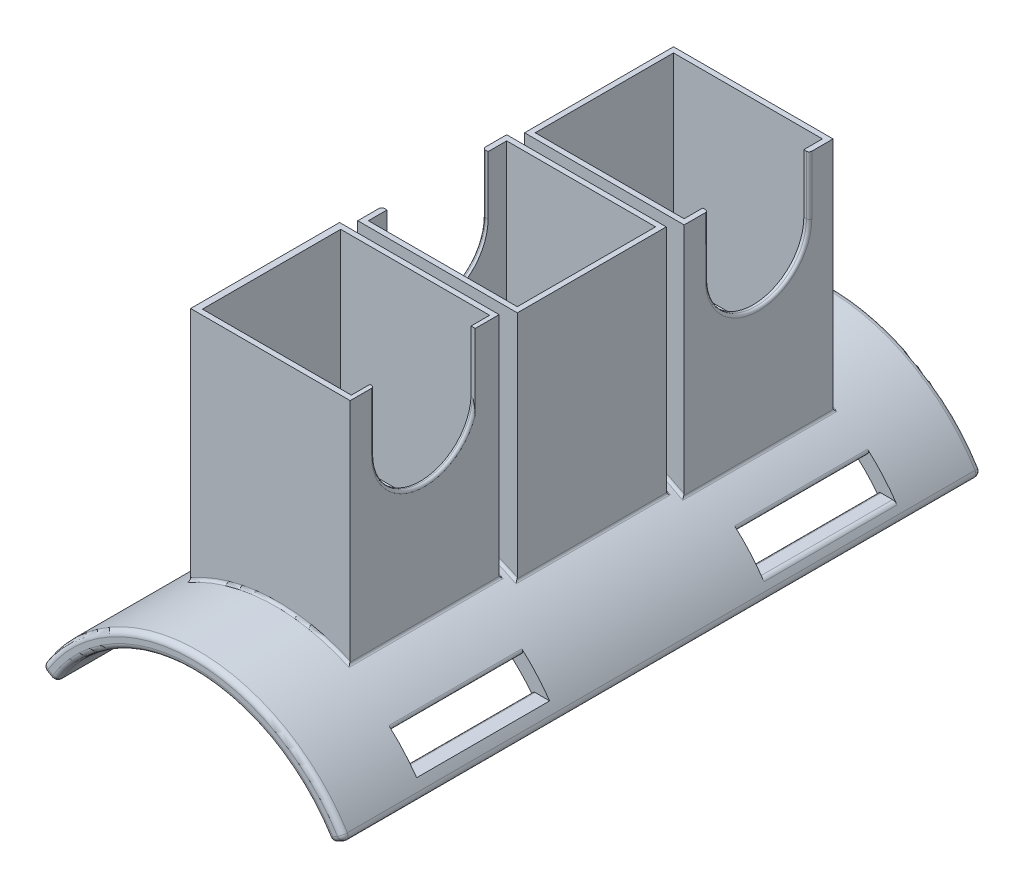
from build123d import *

# Parameters (mm, degrees)
BOSS_EXTRUDE1_DEPTH     = 120
CUT_EXTRUDE1_DEPTH      = 128.6939701003928
CUT_EXTRUDE1_DEPTH_BACK = 128.6939701003928
SKETCH3_W               = 25.00000000000003
SKETCH3_H               = 5.0000000000000036
BOSS_EXTRUDE2_DEPTH     = 73
CUT_EXTRUDE2_DEPTH      = 144.33788752454808
CUT_EXTRUDE2_DEPTH_BACK = 144.33788752454808
SKETCH7_R               = 30.000000000000007
FILLET1_R               = 1
FILLET3_R               = 1
CUT_EXTRUDE3_DEPTH      = 37.000000000000014
SKETCH10_W              = 28
SKETCH10_H              = 26.00000000000002
CUT_EXTRUDE4_DEPTH      = 37
SKETCH11_W              = 28
SKETCH11_H              = 26.000000000000004
CUT_EXTRUDE5_DEPTH      = 37
CUT_EXTRUDE6_DEPTH      = 0.78522646
CUT_EXTRUDE7_DEPTH      = 1
CUT_EXTRUDE8_DEPTH      = 1
FILLET4_R               = 0.5


with BuildPart() as part:
    # Sketch1 → Boss-Extrude1 (new body)
    with BuildSketch(Plane.XY):
        with BuildLine():
            Line((25.9807621135332, 14.999999999999948), (28.57883832488651, 16.49999999999994))
            ThreePointArc((28.57883832488651, 16.49999999999994), (-5.31e-15, 33), (-28.578838324886515, 16.49999999999994))
            Line((-28.578838324886515, 16.49999999999994), (-25.9807621135332, 14.999999999999943))
            ThreePointArc((-25.9807621135332, 14.999999999999943), (-4.82e-15, 30.000000000000007), (25.9807621135332, 14.999999999999948))
        make_face()
    extrude(amount=BOSS_EXTRUDE1_DEPTH)

    # Sketch3 → Cut-Extrude1 (cut, two sides: drawn at the far end of the back side and taken through both)
    with BuildSketch(Plane(origin=(0, 0, 0), x_dir=(0, 0, -1), z_dir=(1, 0, 0)).offset(-CUT_EXTRUDE1_DEPTH_BACK)):
        with Locations((-92.5, 21.35871248321073)):
            Rectangle(SKETCH3_W, SKETCH3_H)
        Polygon((-15, 18.858712483210727), (-40.00000000000001, 18.858712483210724), (-40.00000000000001, 23.858712483210727), (-15, 23.858712483210734), align=None)
    extrude(amount=CUT_EXTRUDE1_DEPTH + CUT_EXTRUDE1_DEPTH_BACK, mode=Mode.SUBTRACT)

    # Sketch6 → Boss-Extrude2 (add)
    with BuildSketch(Plane(origin=(0, 0, 0), x_dir=(1, 0, 0), z_dir=(0, 1, 0))):
        Polygon((-15.000000000000014, -46), (-15.000000000000012, -74), (14.999999999999986, -74), (14.999999999999984, -46), align=None)
        Polygon((-13.640391259651313, -15.99999999999999), (16.35960874034869, -15.99999999999999), (16.35960874034869, -43.99999999999999), (-13.64039125965131, -43.99999999999999), align=None)
        Polygon((-16.420707368271252, -104), (13.579292631728743, -104), (13.57929263172874, -76), (-16.42070736827126, -76), align=None)
    extrude(amount=BOSS_EXTRUDE2_DEPTH)

    # Sketch7 → Cut-Extrude2 (cut, two sides: drawn at the far end of the back side and taken through both)
    with BuildSketch(Plane.XY.offset(-CUT_EXTRUDE2_DEPTH_BACK)):
        Circle(SKETCH7_R)
    extrude(amount=CUT_EXTRUDE2_DEPTH + CUT_EXTRUDE2_DEPTH_BACK, mode=Mode.SUBTRACT)

    # Fillet1
    fillet1_edges = [part.edges().sort_by_distance(p)[0] for p in [
        (8.9e-16, 33.00000000000001, 120),
        (-27.279800219209857, 15.749999999999941, 120),
        (8.9e-16, 30.00000000000001, 120),
        (-27.279800219209857, 15.749999999999941, 0),
        (8.9e-16, 33.00000000000001, 0),
        (27.279800219209854, 15.749999999999943, 0),
        (8.9e-16, 30.00000000000001, 0),
        (-25.980762113533196, 14.999999999999943, 60),
        (-28.578838324886515, 16.499999999999943, 60),
        (28.57883832488651, 16.499999999999936, 60),
        (25.9807621135332, 14.99999999999995, 60),
        (27.279800219209854, 15.749999999999943, 120),
    ]]
    fillet(fillet1_edges, radius=FILLET1_R)

    # Fillet3
    fillet3_edges = [part.edges().sort_by_distance(p)[0] for p in [
        (-22.798285870729067, 23.858712483210738, 27.500000000000004),
        (27.080416604542695, 18.85871248321073, 27.500000000000004),
        (-23.331287222860038, 18.85871248321073, 92.5),
        (-23.331287222860038, 18.85871248321073, 27.500000000000004),
    ]]
    fillet(fillet3_edges, radius=FILLET3_R)

    # Sketch8 → Cut-Extrude3 (cut)
    with BuildSketch(Plane(origin=(0, 73, 0), x_dir=(1, 0, 0), z_dir=(0, 1, 0))):
        Polygon((-15.205933828694487, -103), (12.79406617130552, -103), (12.794066171305513, -77), (-15.205933828694487, -77), align=None)
    extrude(amount=-CUT_EXTRUDE3_DEPTH, mode=Mode.SUBTRACT)

    # Sketch10 → Cut-Extrude4 (cut)
    with BuildSketch(Plane(origin=(0, 73, 0), x_dir=(1, 0, 0), z_dir=(0, 1, 0))):
        with Locations((-1.688e-14, -60)):
            Rectangle(SKETCH10_W, SKETCH10_H)
    extrude(amount=-CUT_EXTRUDE4_DEPTH, mode=Mode.SUBTRACT)

    # Sketch11 → Cut-Extrude5 (cut)
    with BuildSketch(Plane(origin=(0, 73, 0), x_dir=(1, 0, 0), z_dir=(0, 1, 0))):
        with Locations((1.3596087403486834, -29.999999999999986)):
            Rectangle(SKETCH11_W, SKETCH11_H)
    extrude(amount=-CUT_EXTRUDE5_DEPTH, mode=Mode.SUBTRACT)

    # Sketch12 → Cut-Extrude6 (cut)
    with BuildSketch(Plane(origin=(13.57929263172873, 0, -1.68e-15), x_dir=(-1.2e-16, 0, -1), z_dir=(1, 0, -1.2e-16))):
        with BuildLine():
            Line((-99.49999999999999, 73), (-99.49999999999999, 62))
            ThreePointArc((-99.49999999999999, 62), (-90.24350760274669, 52.496711095625905), (-80.5, 61.5))
            Line((-80.5, 61.5), (-80.5, 73))
            Line((-80.5, 73), (-99.49999999999999, 73))
        make_face()
    extrude(amount=-CUT_EXTRUDE6_DEPTH, mode=Mode.SUBTRACT)

    # Sketch13 → Cut-Extrude7 (cut)
    with BuildSketch(Plane(origin=(16.35960874034869, 0, 0), x_dir=(0, 0, -1), z_dir=(1, 0, 0))):
        with BuildLine():
            Line((-39.49999999999999, 73), (-39.499999999999986, 62))
            ThreePointArc((-39.499999999999986, 62), (-29.99999999999999, 52.5), (-20.499999999999993, 62))
            Line((-20.499999999999993, 62), (-20.49999999999999, 73))
            Line((-20.49999999999999, 73), (-39.49999999999999, 73))
        make_face()
    extrude(amount=-CUT_EXTRUDE7_DEPTH, mode=Mode.SUBTRACT)

    # Sketch14 → Cut-Extrude8 (cut)
    with BuildSketch(Plane.ZY.offset(15.00000000000002)):
        with BuildLine():
            Line((50.49999999999999, 73), (50.5, 62))
            ThreePointArc((50.5, 62), (60, 52.5), (69.5, 62))
            Line((69.5, 62), (69.49999999999999, 73))
            Line((69.49999999999999, 73), (50.49999999999999, 73))
        make_face()
    extrude(amount=-CUT_EXTRUDE8_DEPTH, mode=Mode.SUBTRACT)

    # Fillet4
    # the kernel refuses this fillet: 0.5 mm, written as the material it adds along each edge
    with BuildSketch(Plane(origin=(-2.66e-15, 8.88e-15, 74), x_dir=(-0.4879556557238591, 0.8728684196642119, 0), z_dir=(-0.8728684196642119, -0.4879556557238591, 0))) as fillet4_piece_1_section:
        with BuildLine():
            CenterArc((33 + FILLET4_R, -FILLET4_R), FILLET4_R, 90, 90)
            Line((33 + FILLET4_R, 0), (33, 0))
            Line((33, 0), (33, -FILLET4_R))
        make_face()
    fillet4_piece_1 = revolve(axis=Axis((-2.66e-15, 8.88e-15, 74), (0, 0, -1)), revolution_arc=58.412602197524926, mode=Mode.PRIVATE)
    fillet4_piece_1 = split(fillet4_piece_1, bisect_by=Plane(origin=(-15.000000000000014, 8.88e-15, 74), z_dir=(1, 0, -6e-17)), keep=Keep.TOP, mode=Mode.PRIVATE)
    fillet4_piece_1 = split(fillet4_piece_1, bisect_by=Plane(origin=(14.999999999999986, 8.88e-15, 74), z_dir=(-1, 0, 6e-17)), keep=Keep.TOP, mode=Mode.PRIVATE)
    add(fillet4_piece_1)
    with BuildSketch(Plane(origin=(-15.000000000000018, 29.393876913398138, 74), x_dir=(-0.8886320617723285, -0.4586208224560464, 0), z_dir=(0, 0, -1))) as fillet4_piece_2:
        with BuildLine():
            CenterArc((0.30461650689568226, 0.4999947542708441), FILLET4_R, 207.29814744733793, 62.439396894735864)
            Line((-0.13969952399047875, 0.2706843430428146), (0, 0))
            ThreePointArc((0, 0), (0.1511630786098862, 0.00034621812427469), (0.3023261572197686, 0))
        make_face()
    extrude(amount=28)
    with BuildSketch(Plane(origin=(-2.66e-15, 8.88e-15, 46), x_dir=(-0.4879556557238591, 0.8728684196642119, 0), z_dir=(-0.8728684196642119, -0.4879556557238591, 0))) as fillet4_piece_3_section:
        with BuildLine():
            CenterArc((33 + FILLET4_R, FILLET4_R), FILLET4_R, 180, 90)
            Line((33 + FILLET4_R, 0), (33, 0))
            Line((33, 0), (33, FILLET4_R))
        make_face()
    fillet4_piece_3 = revolve(axis=Axis((-2.66e-15, 8.88e-15, 46), (0, 0, -1)), revolution_arc=58.412602197524926, mode=Mode.PRIVATE)
    fillet4_piece_3 = split(fillet4_piece_3, bisect_by=Plane(origin=(-15.000000000000014, 8.88e-15, 46), z_dir=(1, 0, -6e-17)), keep=Keep.TOP, mode=Mode.PRIVATE)
    fillet4_piece_3 = split(fillet4_piece_3, bisect_by=Plane(origin=(14.999999999999982, 8.88e-15, 46), z_dir=(-1, 0, 6e-17)), keep=Keep.TOP, mode=Mode.PRIVATE)
    add(fillet4_piece_3)
    with BuildSketch(Plane(origin=(14.999999999999979, 29.393876913398152, 74), x_dir=(0.8886320617723239, -0.4586208224560554, 0), z_dir=(0, 0, -1))) as fillet4_piece_4:
        with BuildLine():
            CenterArc((0.30461650689568676, -0.49999475427084417), FILLET4_R, 90.2624556579256, 62.4393968947371)
            Line((-0.1396995239904768, -0.2706843430428196), (0, 0))
            ThreePointArc((0, 0), (0.1511630786098862, -0.00034621812427621), (0.3023261572197782, 1e-17))
        make_face()
    extrude(amount=28)
    with BuildSketch(Plane(origin=(-13.640391259651317, 30.048955494053843, 43.99999999999999), x_dir=(-0.9085721037424982, -0.41772806022690323, 0), z_dir=(0, 0, -1))) as fillet4_piece_5:
        with BuildLine():
            CenterArc((0.3204351019267648, 0.49999419530495987), FILLET4_R, 204.69123330855277, 65.03268172909577)
            Line((-0.13385094994448732, 0.2911301651915147), (0, 0))
            ThreePointArc((0, 0), (0.15901290772306084, 0.00038310987266841), (0.31802581544611785, 0))
        make_face()
    extrude(amount=28.000000000000007)
    with BuildSketch(Plane(origin=(-2.66e-15, 8.88e-15, 15.99999999999999), x_dir=(-0.4475368202959961, 0.894265505585086, 0), z_dir=(-0.894265505585086, -0.4475368202959961, 0))) as fillet4_piece_6_section:
        with BuildLine():
            CenterArc((33.00000000000001 + FILLET4_R, FILLET4_R), FILLET4_R, 180, 90.0000000000008)
            Line((33.00000000000001 + FILLET4_R, 0), (33.00000000000001, 0))
            Line((33.00000000000001, 0), (33, FILLET4_R))
        make_face()
    fillet4_piece_6 = revolve(axis=Axis((-2.66e-15, 8.88e-15, 15.99999999999999), (0, 0, -1)), revolution_arc=58.47530437173049, mode=Mode.PRIVATE)
    fillet4_piece_6 = split(fillet4_piece_6, bisect_by=Plane(origin=(-13.640391259651313, 8.88e-15, 15.999999999999991), z_dir=(1, 0, -1.3e-16)), keep=Keep.TOP, mode=Mode.PRIVATE)
    fillet4_piece_6 = split(fillet4_piece_6, bisect_by=Plane(origin=(16.35960874034869, 8.88e-15, 15.99999999999999), z_dir=(-1, 0, 0)), keep=Keep.TOP, mode=Mode.PRIVATE)
    add(fillet4_piece_6)
    with BuildSketch(Plane(origin=(16.35960874034869, 28.659434779191074, 43.99999999999999), x_dir=(0.8663060888794023, -0.4995135237112938, 0), z_dir=(0, 0, -1))) as fillet4_piece_7:
        with BuildLine():
            CenterArc((0.28886509939960664, -0.49999528274977256), FILLET4_R, 90.24888425705, 59.78329553943978)
            Line((-0.14428794504009457, -0.2502385208941256), (0, 0))
            ThreePointArc((0, 0), (0.14334659067949795, -0.00031133851502158), (0.2866931813590018, 0))
        make_face()
    extrude(amount=28.000000000000004)
    with BuildSketch(Plane(origin=(-2.66e-15, 8.88e-15, 43.99999999999999), x_dir=(-0.4475368202959961, 0.894265505585086, 0), z_dir=(-0.894265505585086, -0.4475368202959961, 0))) as fillet4_piece_8_section:
        with BuildLine():
            CenterArc((33.00000000000001 + FILLET4_R, -FILLET4_R), FILLET4_R, 89.99999999999919, 90.0000000000008)
            Line((33.00000000000001 + FILLET4_R, 0), (33.00000000000001, 0))
            Line((33.00000000000001, 0), (33, -FILLET4_R))
        make_face()
    fillet4_piece_8 = revolve(axis=Axis((-2.66e-15, 8.88e-15, 43.99999999999999), (0, 0, -1)), revolution_arc=58.47530437173049, mode=Mode.PRIVATE)
    fillet4_piece_8 = split(fillet4_piece_8, bisect_by=Plane(origin=(-13.64039125965131, 8.88e-15, 43.99999999999999), z_dir=(1, 0, -1.3e-16)), keep=Keep.TOP, mode=Mode.PRIVATE)
    fillet4_piece_8 = split(fillet4_piece_8, bisect_by=Plane(origin=(16.35960874034869, 8.88e-15, 43.99999999999999), z_dir=(-1, 0, 0)), keep=Keep.TOP, mode=Mode.PRIVATE)
    add(fillet4_piece_8)
    with BuildSketch(Plane(origin=(13.57929263172873, 30.07661569428778, 104), x_dir=(0.9094147414784837, -0.4158904038104543, 0), z_dir=(0, 0, -1))) as fillet4_piece_9:
        with BuildLine():
            CenterArc((0.32114854714030044, -0.499994169427856), FILLET4_R, 90.27669966724343, 65.14789835848904)
            Line((-0.13355882359894436, -0.2920489675226353), (0, 0))
            ThreePointArc((0, 0), (0.15936694820496203, -0.00038481776159361), (0.31873389640992245, 0))
        make_face()
    extrude(amount=28)
    with BuildSketch(Plane(origin=(-2.66e-15, 8.88e-15, 104), x_dir=(-0.5300934426872469, 0.8479392325043007, 0), z_dir=(-0.8479392325043007, -0.5300934426872469, 0))) as fillet4_piece_10_section:
        with BuildLine():
            CenterArc((32.99999999999999 + FILLET4_R, -FILLET4_R), FILLET4_R, 90, 90)
            Line((32.99999999999999 + FILLET4_R, 0), (32.99999999999999, 0))
            Line((32.99999999999999, 0), (32.99999999999999, -FILLET4_R))
        make_face()
    fillet4_piece_10 = revolve(axis=Axis((-2.66e-15, 8.88e-15, 104), (0, 0, -1)), revolution_arc=58.48108100446816, mode=Mode.PRIVATE)
    fillet4_piece_10 = split(fillet4_piece_10, bisect_by=Plane(origin=(-16.420707368271252, 8.88e-15, 104), z_dir=(1, 0, -2.5e-16)), keep=Keep.TOP, mode=Mode.PRIVATE)
    fillet4_piece_10 = split(fillet4_piece_10, bisect_by=Plane(origin=(13.579292631728741, 8.88e-15, 104), z_dir=(-1, 0, 1.3e-16)), keep=Keep.TOP, mode=Mode.PRIVATE)
    add(fillet4_piece_10)
    with BuildSketch(Plane(origin=(-16.420707368271277, 28.62447151521932, 104), x_dir=(-0.8652438961401427, -0.5013511745196434, 0), z_dir=(0, 0, -1))) as fillet4_piece_11:
        with BuildLine():
            CenterArc((0.2881577868201644, 0.4999953058228339), FILLET4_R, 210.08943332114373, 59.66229184146016)
            Line((-0.14446416124990516, 0.24931971856300914), (0, 0))
            ThreePointArc((0, 0), (0.1429955934596284, 0.00030981569294206), (0.2859911869192513, 0))
        make_face()
    extrude(amount=28)
    with BuildSketch(Plane(origin=(-2.66e-15, 8.88e-15, 76), x_dir=(-0.5300934426872477, 0.8479392325043004, 0), z_dir=(-0.8479392325043004, -0.5300934426872477, 0))) as fillet4_piece_12_section:
        with BuildLine():
            CenterArc((33 + FILLET4_R, FILLET4_R), FILLET4_R, 180, 90)
            Line((33 + FILLET4_R, 0), (33, 0))
            Line((33, 0), (33, FILLET4_R))
        make_face()
    fillet4_piece_12 = revolve(axis=Axis((-2.66e-15, 8.88e-15, 76), (0, 0, -1)), revolution_arc=58.48108100446816, mode=Mode.PRIVATE)
    fillet4_piece_12 = split(fillet4_piece_12, bisect_by=Plane(origin=(-16.42070736827126, 8.88e-15, 76), z_dir=(1, 0, -2.5e-16)), keep=Keep.TOP, mode=Mode.PRIVATE)
    fillet4_piece_12 = split(fillet4_piece_12, bisect_by=Plane(origin=(13.579292631728737, 8.88e-15, 76), z_dir=(-1, 0, 1.3e-16)), keep=Keep.TOP, mode=Mode.PRIVATE)
    add(fillet4_piece_12)
    with BuildSketch(Plane(origin=(-15.000000000000018, 29.393876913398138, 74.76151974109214), x_dir=(-0.8886320617723285, -0.4586208224560464, 0), z_dir=(0, 0, -1))) as fillet4_piece_13a_section:
        with BuildLine():
            CenterArc((0.30461650689568226, 0.4999947542708441), FILLET4_R, 207.29814744733793, 62.439396894735864)
            Line((-0.13969952399047875, 0.2706843430428146), (0, 0))
            ThreePointArc((0, 0), (0.1511630786098862, 0.00034621812427469), (0.3023261572197686, 0))
        make_face()
    fillet4_piece_13a = extrude(amount=28.761519741092144, mode=Mode.PRIVATE)
    fillet4_piece_13a = split(fillet4_piece_13a, bisect_by=Plane(origin=(-15.000000000000018, 29.393876913398138, 74), z_dir=(0, 0, 1)), keep=Keep.TOP, mode=Mode.PRIVATE)
    with BuildSketch(Plane(origin=(-2.66e-15, 8.88e-15, 74), x_dir=(-0.4879556557238591, 0.8728684196642119, 0), z_dir=(-0.8728684196642119, -0.4879556557238591, 0))) as fillet4_piece_13b_section:
        with BuildLine():
            CenterArc((33 + FILLET4_R, -FILLET4_R), FILLET4_R, 90, 90)
            Line((33 + FILLET4_R, 0), (33, 0))
            Line((33, 0), (33, -FILLET4_R))
        make_face()
    fillet4_piece_13b = revolve(axis=Axis((-2.66e-15, 8.88e-15, 74), (0, 0, -1)), revolution_arc=58.412602197524926, mode=Mode.PRIVATE)
    fillet4_piece_13b = split(fillet4_piece_13b, bisect_by=Plane(origin=(-15.000000000000014, 8.88e-15, 74), z_dir=(-1, 0, 6e-17)), keep=Keep.TOP, mode=Mode.PRIVATE)
    fillet4_piece_13 = fillet4_piece_13a & fillet4_piece_13b
    add(fillet4_piece_13)
    with BuildSketch(Plane(origin=(-2.66e-15, 8.88e-15, 74), x_dir=(-0.4879556557238591, 0.8728684196642119, 0), z_dir=(-0.8728684196642119, -0.4879556557238591, 0))) as fillet4_piece_14a_section:
        with BuildLine():
            CenterArc((33 + FILLET4_R, -FILLET4_R), FILLET4_R, 90, 90)
            Line((33 + FILLET4_R, 0), (33, 0))
            Line((33, 0), (33, -FILLET4_R))
        make_face()
    fillet4_piece_14a = revolve(axis=Axis((-2.66e-15, 8.88e-15, 74), (0, 0, -1)), revolution_arc=58.412602197524926, mode=Mode.PRIVATE)
    fillet4_piece_14a = split(fillet4_piece_14a, bisect_by=Plane(origin=(14.999999999999986, 8.88e-15, 74), z_dir=(1, 0, -6e-17)), keep=Keep.TOP, mode=Mode.PRIVATE)
    with BuildSketch(Plane(origin=(14.999999999999979, 29.393876913398152, 74.76151974109214), x_dir=(0.8886320617723239, -0.4586208224560554, 0), z_dir=(0, 0, -1))) as fillet4_piece_14b_section:
        with BuildLine():
            CenterArc((0.30461650689568676, -0.49999475427084417), FILLET4_R, 90.2624556579256, 62.4393968947371)
            Line((-0.1396995239904768, -0.2706843430428196), (0, 0))
            ThreePointArc((0, 0), (0.1511630786098862, -0.00034621812427621), (0.3023261572197782, 1e-17))
        make_face()
    fillet4_piece_14b = extrude(amount=28.761519741092144, mode=Mode.PRIVATE)
    fillet4_piece_14b = split(fillet4_piece_14b, bisect_by=Plane(origin=(14.999999999999979, 29.393876913398152, 74), z_dir=(0, 0, 1)), keep=Keep.TOP, mode=Mode.PRIVATE)
    fillet4_piece_14 = fillet4_piece_14a & fillet4_piece_14b
    add(fillet4_piece_14)
    with BuildSketch(Plane(origin=(-15.000000000000018, 29.393876913398138, 74), x_dir=(-0.8886320617723285, -0.4586208224560464, 0), z_dir=(0, 0, -1))) as fillet4_piece_15a_section:
        with BuildLine():
            CenterArc((0.30461650689568226, 0.4999947542708441), FILLET4_R, 207.29814744733793, 62.439396894735864)
            Line((-0.13969952399047875, 0.2706843430428146), (0, 0))
            ThreePointArc((0, 0), (0.1511630786098862, 0.00034621812427469), (0.3023261572197686, 0))
        make_face()
    fillet4_piece_15a = extrude(amount=28.761519741092137, mode=Mode.PRIVATE)
    fillet4_piece_15a = split(fillet4_piece_15a, bisect_by=Plane(origin=(-15.000000000000018, 29.393876913398138, 46), z_dir=(0, 0, -1)), keep=Keep.TOP, mode=Mode.PRIVATE)
    with BuildSketch(Plane(origin=(-2.66e-15, 8.88e-15, 46), x_dir=(-0.4879556557238591, 0.8728684196642119, 0), z_dir=(-0.8728684196642119, -0.4879556557238591, 0))) as fillet4_piece_15b_section:
        with BuildLine():
            CenterArc((33 + FILLET4_R, FILLET4_R), FILLET4_R, 180, 90)
            Line((33 + FILLET4_R, 0), (33, 0))
            Line((33, 0), (33, FILLET4_R))
        make_face()
    fillet4_piece_15b = revolve(axis=Axis((-2.66e-15, 8.88e-15, 46), (0, 0, -1)), revolution_arc=58.412602197524926, mode=Mode.PRIVATE)
    fillet4_piece_15b = split(fillet4_piece_15b, bisect_by=Plane(origin=(-15.000000000000014, 8.88e-15, 46), z_dir=(-1, 0, 6e-17)), keep=Keep.TOP, mode=Mode.PRIVATE)
    fillet4_piece_15 = fillet4_piece_15a & fillet4_piece_15b
    add(fillet4_piece_15)
    with BuildSketch(Plane(origin=(14.999999999999979, 29.393876913398152, 74), x_dir=(0.8886320617723239, -0.4586208224560554, 0), z_dir=(0, 0, -1))) as fillet4_piece_16a_section:
        with BuildLine():
            CenterArc((0.30461650689568676, -0.49999475427084417), FILLET4_R, 90.2624556579256, 62.4393968947371)
            Line((-0.1396995239904768, -0.2706843430428196), (0, 0))
            ThreePointArc((0, 0), (0.1511630786098862, -0.00034621812427621), (0.3023261572197782, 1e-17))
        make_face()
    fillet4_piece_16a = extrude(amount=28.76151974109215, mode=Mode.PRIVATE)
    fillet4_piece_16a = split(fillet4_piece_16a, bisect_by=Plane(origin=(14.999999999999979, 29.393876913398152, 46), z_dir=(0, 0, -1)), keep=Keep.TOP, mode=Mode.PRIVATE)
    with BuildSketch(Plane(origin=(-2.66e-15, 8.88e-15, 46), x_dir=(-0.4879556557238591, 0.8728684196642119, 0), z_dir=(-0.8728684196642119, -0.4879556557238591, 0))) as fillet4_piece_16b_section:
        with BuildLine():
            CenterArc((33 + FILLET4_R, FILLET4_R), FILLET4_R, 180, 90)
            Line((33 + FILLET4_R, 0), (33, 0))
            Line((33, 0), (33, FILLET4_R))
        make_face()
    fillet4_piece_16b = revolve(axis=Axis((-2.66e-15, 8.88e-15, 46), (0, 0, -1)), revolution_arc=58.412602197524926, mode=Mode.PRIVATE)
    fillet4_piece_16b = split(fillet4_piece_16b, bisect_by=Plane(origin=(14.999999999999982, 8.88e-15, 46), z_dir=(1, 0, -6e-17)), keep=Keep.TOP, mode=Mode.PRIVATE)
    fillet4_piece_16 = fillet4_piece_16a & fillet4_piece_16b
    add(fillet4_piece_16)
    with BuildSketch(Plane(origin=(-13.640391259651317, 30.048955494053843, 44.80106511082698), x_dir=(-0.9085721037424982, -0.41772806022690323, 0), z_dir=(0, 0, -1))) as fillet4_piece_17a_section:
        with BuildLine():
            CenterArc((0.3204351019267648, 0.49999419530495987), FILLET4_R, 204.69123330855277, 65.03268172909577)
            Line((-0.13385094994448732, 0.2911301651915147), (0, 0))
            ThreePointArc((0, 0), (0.15901290772306084, 0.00038310987266841), (0.31802581544611785, 0))
        make_face()
    fillet4_piece_17a = extrude(amount=28.801065110826997, mode=Mode.PRIVATE)
    fillet4_piece_17a = split(fillet4_piece_17a, bisect_by=Plane(origin=(-13.640391259651317, 30.048955494053843, 43.99999999999999), z_dir=(0, 0, 1)), keep=Keep.TOP, mode=Mode.PRIVATE)
    with BuildSketch(Plane(origin=(-2.66e-15, 8.88e-15, 43.99999999999999), x_dir=(-0.4475368202959961, 0.894265505585086, 0), z_dir=(-0.894265505585086, -0.4475368202959961, 0))) as fillet4_piece_17b_section:
        with BuildLine():
            CenterArc((33.00000000000001 + FILLET4_R, -FILLET4_R), FILLET4_R, 89.99999999999919, 90.0000000000008)
            Line((33.00000000000001 + FILLET4_R, 0), (33.00000000000001, 0))
            Line((33.00000000000001, 0), (33, -FILLET4_R))
        make_face()
    fillet4_piece_17b = revolve(axis=Axis((-2.66e-15, 8.88e-15, 43.99999999999999), (0, 0, -1)), revolution_arc=58.47530437173049, mode=Mode.PRIVATE)
    fillet4_piece_17b = split(fillet4_piece_17b, bisect_by=Plane(origin=(-13.64039125965131, 8.88e-15, 43.99999999999999), z_dir=(-1, 0, 1.3e-16)), keep=Keep.TOP, mode=Mode.PRIVATE)
    fillet4_piece_17 = fillet4_piece_17a & fillet4_piece_17b
    add(fillet4_piece_17)
    with BuildSketch(Plane(origin=(-2.66e-15, 8.88e-15, 15.99999999999999), x_dir=(-0.4475368202959961, 0.894265505585086, 0), z_dir=(-0.894265505585086, -0.4475368202959961, 0))) as fillet4_piece_18a_section:
        with BuildLine():
            CenterArc((33.00000000000001 + FILLET4_R, FILLET4_R), FILLET4_R, 180, 90.0000000000008)
            Line((33.00000000000001 + FILLET4_R, 0), (33.00000000000001, 0))
            Line((33.00000000000001, 0), (33, FILLET4_R))
        make_face()
    fillet4_piece_18a = revolve(axis=Axis((-2.66e-15, 8.88e-15, 15.99999999999999), (0, 0, -1)), revolution_arc=58.47530437173049, mode=Mode.PRIVATE)
    fillet4_piece_18a = split(fillet4_piece_18a, bisect_by=Plane(origin=(-13.640391259651313, 8.88e-15, 15.999999999999991), z_dir=(-1, 0, 1.3e-16)), keep=Keep.TOP, mode=Mode.PRIVATE)
    with BuildSketch(Plane(origin=(-13.640391259651317, 30.048955494053843, 43.99999999999999), x_dir=(-0.9085721037424982, -0.41772806022690323, 0), z_dir=(0, 0, -1))) as fillet4_piece_18b_section:
        with BuildLine():
            CenterArc((0.3204351019267648, 0.49999419530495987), FILLET4_R, 204.69123330855277, 65.03268172909577)
            Line((-0.13385094994448732, 0.2911301651915147), (0, 0))
            ThreePointArc((0, 0), (0.15901290772306084, 0.00038310987266841), (0.31802581544611785, 0))
        make_face()
    fillet4_piece_18b = extrude(amount=28.80106511082699, mode=Mode.PRIVATE)
    fillet4_piece_18b = split(fillet4_piece_18b, bisect_by=Plane(origin=(-13.640391259651317, 30.048955494053843, 15.99999999999999), z_dir=(0, 0, -1)), keep=Keep.TOP, mode=Mode.PRIVATE)
    fillet4_piece_18 = fillet4_piece_18a & fillet4_piece_18b
    add(fillet4_piece_18)
    with BuildSketch(Plane(origin=(-2.66e-15, 8.88e-15, 15.99999999999999), x_dir=(-0.4475368202959961, 0.894265505585086, 0), z_dir=(-0.894265505585086, -0.4475368202959961, 0))) as fillet4_piece_19a_section:
        with BuildLine():
            CenterArc((33.00000000000001 + FILLET4_R, FILLET4_R), FILLET4_R, 180, 90.0000000000008)
            Line((33.00000000000001 + FILLET4_R, 0), (33.00000000000001, 0))
            Line((33.00000000000001, 0), (33, FILLET4_R))
        make_face()
    fillet4_piece_19a = revolve(axis=Axis((-2.66e-15, 8.88e-15, 15.99999999999999), (0, 0, -1)), revolution_arc=58.47530437173049, mode=Mode.PRIVATE)
    fillet4_piece_19a = split(fillet4_piece_19a, bisect_by=Plane(origin=(16.35960874034869, 8.88e-15, 15.99999999999999), z_dir=(1, 0, 0)), keep=Keep.TOP, mode=Mode.PRIVATE)
    with BuildSketch(Plane(origin=(16.35960874034869, 28.659434779191074, 43.99999999999999), x_dir=(0.8663060888794023, -0.4995135237112938, 0), z_dir=(0, 0, -1))) as fillet4_piece_19b_section:
        with BuildLine():
            CenterArc((0.28886509939960664, -0.49999528274977256), FILLET4_R, 90.24888425705, 59.78329553943978)
            Line((-0.14428794504009457, -0.2502385208941256), (0, 0))
            ThreePointArc((0, 0), (0.14334659067949795, -0.00031133851502158), (0.2866931813590018, 0))
        make_face()
    fillet4_piece_19b = extrude(amount=28.722142335446993, mode=Mode.PRIVATE)
    fillet4_piece_19b = split(fillet4_piece_19b, bisect_by=Plane(origin=(16.35960874034869, 28.659434779191074, 15.99999999999999), z_dir=(0, 0, -1)), keep=Keep.TOP, mode=Mode.PRIVATE)
    fillet4_piece_19 = fillet4_piece_19a & fillet4_piece_19b
    add(fillet4_piece_19)
    with BuildSketch(Plane(origin=(-2.66e-15, 8.88e-15, 43.99999999999999), x_dir=(-0.4475368202959961, 0.894265505585086, 0), z_dir=(-0.894265505585086, -0.4475368202959961, 0))) as fillet4_piece_20a_section:
        with BuildLine():
            CenterArc((33.00000000000001 + FILLET4_R, -FILLET4_R), FILLET4_R, 89.99999999999919, 90.0000000000008)
            Line((33.00000000000001 + FILLET4_R, 0), (33.00000000000001, 0))
            Line((33.00000000000001, 0), (33, -FILLET4_R))
        make_face()
    fillet4_piece_20a = revolve(axis=Axis((-2.66e-15, 8.88e-15, 43.99999999999999), (0, 0, -1)), revolution_arc=58.47530437173049, mode=Mode.PRIVATE)
    fillet4_piece_20a = split(fillet4_piece_20a, bisect_by=Plane(origin=(16.35960874034869, 8.88e-15, 43.99999999999999), z_dir=(1, 0, 0)), keep=Keep.TOP, mode=Mode.PRIVATE)
    with BuildSketch(Plane(origin=(16.35960874034869, 28.659434779191074, 44.72214233544698), x_dir=(0.8663060888794023, -0.4995135237112938, 0), z_dir=(0, 0, -1))) as fillet4_piece_20b_section:
        with BuildLine():
            CenterArc((0.28886509939960664, -0.49999528274977256), FILLET4_R, 90.24888425705, 59.78329553943978)
            Line((-0.14428794504009457, -0.2502385208941256), (0, 0))
            ThreePointArc((0, 0), (0.14334659067949795, -0.00031133851502158), (0.2866931813590018, 0))
        make_face()
    fillet4_piece_20b = extrude(amount=28.722142335446993, mode=Mode.PRIVATE)
    fillet4_piece_20b = split(fillet4_piece_20b, bisect_by=Plane(origin=(16.35960874034869, 28.659434779191074, 43.99999999999999), z_dir=(0, 0, 1)), keep=Keep.TOP, mode=Mode.PRIVATE)
    fillet4_piece_20 = fillet4_piece_20a & fillet4_piece_20b
    add(fillet4_piece_20)
    with BuildSketch(Plane(origin=(-2.66e-15, 8.88e-15, 104), x_dir=(-0.5300934426872469, 0.8479392325043007, 0), z_dir=(-0.8479392325043007, -0.5300934426872469, 0))) as fillet4_piece_21a_section:
        with BuildLine():
            CenterArc((32.99999999999999 + FILLET4_R, -FILLET4_R), FILLET4_R, 90, 90)
            Line((32.99999999999999 + FILLET4_R, 0), (32.99999999999999, 0))
            Line((32.99999999999999, 0), (32.99999999999999, -FILLET4_R))
        make_face()
    fillet4_piece_21a = revolve(axis=Axis((-2.66e-15, 8.88e-15, 104), (0, 0, -1)), revolution_arc=58.48108100446816, mode=Mode.PRIVATE)
    fillet4_piece_21a = split(fillet4_piece_21a, bisect_by=Plane(origin=(13.579292631728741, 8.88e-15, 104), z_dir=(1, 0, -1.3e-16)), keep=Keep.TOP, mode=Mode.PRIVATE)
    with BuildSketch(Plane(origin=(13.57929263172873, 30.07661569428778, 104.80284867344417), x_dir=(0.9094147414784837, -0.4158904038104543, 0), z_dir=(0, 0, -1))) as fillet4_piece_21b_section:
        with BuildLine():
            CenterArc((0.32114854714030044, -0.499994169427856), FILLET4_R, 90.27669966724343, 65.14789835848904)
            Line((-0.13355882359894436, -0.2920489675226353), (0, 0))
            ThreePointArc((0, 0), (0.15936694820496203, -0.00038481776159361), (0.31873389640992245, 0))
        make_face()
    fillet4_piece_21b = extrude(amount=28.802848673444174, mode=Mode.PRIVATE)
    fillet4_piece_21b = split(fillet4_piece_21b, bisect_by=Plane(origin=(13.57929263172873, 30.07661569428778, 104), z_dir=(0, 0, 1)), keep=Keep.TOP, mode=Mode.PRIVATE)
    fillet4_piece_21 = fillet4_piece_21a & fillet4_piece_21b
    add(fillet4_piece_21)
    with BuildSketch(Plane(origin=(13.57929263172873, 30.07661569428778, 104), x_dir=(0.9094147414784837, -0.4158904038104543, 0), z_dir=(0, 0, -1))) as fillet4_piece_22a_section:
        with BuildLine():
            CenterArc((0.32114854714030044, -0.499994169427856), FILLET4_R, 90.27669966724343, 65.14789835848904)
            Line((-0.13355882359894436, -0.2920489675226353), (0, 0))
            ThreePointArc((0, 0), (0.15936694820496203, -0.00038481776159361), (0.31873389640992245, 0))
        make_face()
    fillet4_piece_22a = extrude(amount=28.802848673444174, mode=Mode.PRIVATE)
    fillet4_piece_22a = split(fillet4_piece_22a, bisect_by=Plane(origin=(13.57929263172873, 30.07661569428778, 76), z_dir=(0, 0, -1)), keep=Keep.TOP, mode=Mode.PRIVATE)
    with BuildSketch(Plane(origin=(-2.66e-15, 8.88e-15, 76), x_dir=(-0.5300934426872477, 0.8479392325043004, 0), z_dir=(-0.8479392325043004, -0.5300934426872477, 0))) as fillet4_piece_22b_section:
        with BuildLine():
            CenterArc((33 + FILLET4_R, FILLET4_R), FILLET4_R, 180, 90)
            Line((33 + FILLET4_R, 0), (33, 0))
            Line((33, 0), (33, FILLET4_R))
        make_face()
    fillet4_piece_22b = revolve(axis=Axis((-2.66e-15, 8.88e-15, 76), (0, 0, -1)), revolution_arc=58.48108100446816, mode=Mode.PRIVATE)
    fillet4_piece_22b = split(fillet4_piece_22b, bisect_by=Plane(origin=(13.579292631728737, 8.88e-15, 76), z_dir=(1, 0, -1.3e-16)), keep=Keep.TOP, mode=Mode.PRIVATE)
    fillet4_piece_22 = fillet4_piece_22a & fillet4_piece_22b
    add(fillet4_piece_22)
    with BuildSketch(Plane(origin=(-16.420707368271277, 28.62447151521932, 104.72037410398164), x_dir=(-0.8652438961401427, -0.5013511745196434, 0), z_dir=(0, 0, -1))) as fillet4_piece_23a_section:
        with BuildLine():
            CenterArc((0.2881577868201644, 0.4999953058228339), FILLET4_R, 210.08943332114373, 59.66229184146016)
            Line((-0.14446416124990516, 0.24931971856300914), (0, 0))
            ThreePointArc((0, 0), (0.1429955934596284, 0.00030981569294206), (0.2859911869192513, 0))
        make_face()
    fillet4_piece_23a = extrude(amount=28.72037410398164, mode=Mode.PRIVATE)
    fillet4_piece_23a = split(fillet4_piece_23a, bisect_by=Plane(origin=(-16.420707368271277, 28.62447151521932, 104), z_dir=(0, 0, 1)), keep=Keep.TOP, mode=Mode.PRIVATE)
    with BuildSketch(Plane(origin=(-2.66e-15, 8.88e-15, 104), x_dir=(-0.5300934426872469, 0.8479392325043007, 0), z_dir=(-0.8479392325043007, -0.5300934426872469, 0))) as fillet4_piece_23b_section:
        with BuildLine():
            CenterArc((32.99999999999999 + FILLET4_R, -FILLET4_R), FILLET4_R, 90, 90)
            Line((32.99999999999999 + FILLET4_R, 0), (32.99999999999999, 0))
            Line((32.99999999999999, 0), (32.99999999999999, -FILLET4_R))
        make_face()
    fillet4_piece_23b = revolve(axis=Axis((-2.66e-15, 8.88e-15, 104), (0, 0, -1)), revolution_arc=58.48108100446816, mode=Mode.PRIVATE)
    fillet4_piece_23b = split(fillet4_piece_23b, bisect_by=Plane(origin=(-16.420707368271252, 8.88e-15, 104), z_dir=(-1, 0, 2.5e-16)), keep=Keep.TOP, mode=Mode.PRIVATE)
    fillet4_piece_23 = fillet4_piece_23a & fillet4_piece_23b
    add(fillet4_piece_23)
    with BuildSketch(Plane(origin=(-16.420707368271277, 28.62447151521932, 104), x_dir=(-0.8652438961401427, -0.5013511745196434, 0), z_dir=(0, 0, -1))) as fillet4_piece_24a_section:
        with BuildLine():
            CenterArc((0.2881577868201644, 0.4999953058228339), FILLET4_R, 210.08943332114373, 59.66229184146016)
            Line((-0.14446416124990516, 0.24931971856300914), (0, 0))
            ThreePointArc((0, 0), (0.1429955934596284, 0.00030981569294206), (0.2859911869192513, 0))
        make_face()
    fillet4_piece_24a = extrude(amount=28.72037410398164, mode=Mode.PRIVATE)
    fillet4_piece_24a = split(fillet4_piece_24a, bisect_by=Plane(origin=(-16.420707368271277, 28.62447151521932, 76), z_dir=(0, 0, -1)), keep=Keep.TOP, mode=Mode.PRIVATE)
    with BuildSketch(Plane(origin=(-2.66e-15, 8.88e-15, 76), x_dir=(-0.5300934426872477, 0.8479392325043004, 0), z_dir=(-0.8479392325043004, -0.5300934426872477, 0))) as fillet4_piece_24b_section:
        with BuildLine():
            CenterArc((33 + FILLET4_R, FILLET4_R), FILLET4_R, 180, 90)
            Line((33 + FILLET4_R, 0), (33, 0))
            Line((33, 0), (33, FILLET4_R))
        make_face()
    fillet4_piece_24b = revolve(axis=Axis((-2.66e-15, 8.88e-15, 76), (0, 0, -1)), revolution_arc=58.48108100446816, mode=Mode.PRIVATE)
    fillet4_piece_24b = split(fillet4_piece_24b, bisect_by=Plane(origin=(-16.42070736827126, 8.88e-15, 76), z_dir=(-1, 0, 2.5e-16)), keep=Keep.TOP, mode=Mode.PRIVATE)
    fillet4_piece_24 = fillet4_piece_24a & fillet4_piece_24b
    add(fillet4_piece_24)
    # the kernel refuses this fillet: 0.5 mm, written as the material it takes off along each edge
    with BuildSketch(Plane(origin=(22.79828587072906, 23.858712483210738, 40.00000000000001), x_dir=(-0.7363863796825724, 0.6765612313885524, 0), z_dir=(0, 0, -1))) as fillet4_2_piece_1:
        with BuildLine():
            CenterArc((1.283139637590676, -0.49990404957042067), FILLET4_R, 88.87750856680243, 138.54698498580473)
            Line((0.9448590218963973, -0.8680972394117046), (0, 0))
            ThreePointArc((0, 0), (0.646467298328132, 0.00633272835236611), (1.2929345966562547, 2e-17))
        make_face()
    extrude(amount=25.000000000000007, mode=Mode.SUBTRACT)
    with BuildSketch(Plane(origin=(22.798285870729067, 23.85871248321073, 105), x_dir=(-0.7363863796825746, 0.67656123138855, 0), z_dir=(0, 0, -1))) as fillet4_2_piece_2:
        with BuildLine():
            CenterArc((1.2831396375906903, -0.49990404957041845), FILLET4_R, 88.8775085668023, 138.5469849858054)
            Line((0.9448590218964154, -0.8680972394117058), (0, 0))
            ThreePointArc((0, 0), (0.646467298328142, 0.00633272835236866), (1.29293459665627, -2e-17))
        make_face()
    extrude(amount=25.000000000000014, mode=Mode.SUBTRACT)
    with BuildSketch(Plane(origin=(23.331287222860045, 18.85871248321073, 105), x_dir=(0.615362628083865, -0.788244147430045, 0), z_dir=(0, 0, -1))) as fillet4_2_piece_3:
        with BuildLine():
            CenterArc((1.024602833851699, -0.4999282913562568), FILLET4_R, 90.97038387892788, 127.00789033891397)
            Line((0.630480760137807, -0.8076096053996371), (0, 0))
            ThreePointArc((0, 0), (0.5080675209181981, -0.00430251862463953), (1.0161350418363944, 4e-17))
        make_face()
    extrude(amount=25.000000000000014, mode=Mode.SUBTRACT)
    with BuildSketch(Plane(origin=(13.579292631728743, 74.25, 99.49999999999999), x_dir=(-1, 0, 0), z_dir=(0, -1, 0))) as fillet4_2_piece_4:
        with BuildLine():
            CenterArc((FILLET4_R, -FILLET4_R), FILLET4_R, 90, 90)
            Line((0, -FILLET4_R), (0, 0))
            Line((0, 0), (FILLET4_R, 0))
        make_face()
    extrude(amount=12.25, mode=Mode.SUBTRACT)
    with BuildSketch(Plane(origin=(13.579292631728741, 62, 89.99342105263158), x_dir=(1.9e-16, 0, 1), z_dir=(0, 1, 0))) as fillet4_2_piece_5_section:
        with BuildLine():
            CenterArc((9.506578947368425 + FILLET4_R, -FILLET4_R), FILLET4_R, 89.99999999999837, 90.00000000000165)
            Line((9.506578947368425 + FILLET4_R, -9e-17), (9.506578947368425, 0))
            Line((9.506578947368425, 0), (9.50657894736841, -FILLET4_R))
        make_face()
    fillet4_2_piece_5 = revolve(axis=Axis((13.579292631728741, 62, 89.99342105263158), (1, 0, -1.2e-16)), revolution_arc=199.6213699829495, mode=Mode.PRIVATE)
    fillet4_2_piece_5 = split(fillet4_2_piece_5, bisect_by=Plane(origin=(13.57929263172874, 62, 80.5), z_dir=(1.2e-16, 0, 1)), keep=Keep.TOP, mode=Mode.PRIVATE)
    add(fillet4_2_piece_5, mode=Mode.SUBTRACT)
    with BuildSketch(Plane(origin=(16.35960874034869, 74.25, 39.49999999999999), x_dir=(0, -6.5e-16, 1), z_dir=(0, -1, -6.5e-16))) as fillet4_2_piece_6:
        with BuildLine():
            CenterArc((FILLET4_R, FILLET4_R), FILLET4_R, 180, 90)
            Line((0, FILLET4_R), (0, 0))
            Line((0, 0), (FILLET4_R, 0))
        make_face()
    extrude(amount=12.25, mode=Mode.SUBTRACT)
    with BuildSketch(Plane(origin=(16.35960874034869, 61.99999999999999, 29.99999999999999), x_dir=(0, 7.5e-16, 1), z_dir=(0, 1, -7.5e-16))) as fillet4_2_piece_7:
        with BuildLine():
            CenterArc((9.499999999999996 + FILLET4_R, -FILLET4_R), FILLET4_R, 90, 90)
            Line((9.499999999999996, -FILLET4_R), (9.499999999999996, 0))
            Line((9.499999999999996, 0), (9.499999999999996 + FILLET4_R, 0))
        make_face()
    revolve(axis=Axis((16.35960874034869, 61.99999999999999, 29.99999999999999), (1, 0, 0)), revolution_arc=180.00000000000009, mode=Mode.SUBTRACT)
    with BuildSketch(Plane(origin=(16.35960874034869, 62, 20.499999999999993), x_dir=(0, -3.2e-16, -1), z_dir=(0, 1, -3.2e-16))) as fillet4_2_piece_8:
        with BuildLine():
            CenterArc((FILLET4_R, FILLET4_R), FILLET4_R, 180, 90)
            Line((0, FILLET4_R), (0, 0))
            Line((0, 0), (FILLET4_R, 0))
        make_face()
    extrude(amount=12.25, mode=Mode.SUBTRACT)
    with BuildSketch(Plane(origin=(-15.000000000000012, 74.25, 50.49999999999999), x_dir=(-7.11e-15, -6.5e-16, -1), z_dir=(0, -1, 6.5e-16)), Plane(origin=(-15.00000000000001, 62, 69.5), x_dir=(-7.11e-15, 1.29e-15, 1), z_dir=(0, 1, -1.29e-15))) as fillet4_2_piece_9:
        with BuildLine():
            CenterArc((FILLET4_R, FILLET4_R), FILLET4_R, 180, 90.0000000000004)
            Line((-3.55e-15, FILLET4_R), (0, 0))
            Line((0, 0), (FILLET4_R, 0))
        make_face()
    extrude(amount=12.25, mode=Mode.SUBTRACT)
    with BuildSketch(Plane(origin=(-15.000000000000012, 62, 60), x_dir=(0, 0, -1), z_dir=(0, 1, 0))) as fillet4_2_piece_10:
        with BuildLine():
            CenterArc((9.5 + FILLET4_R, -FILLET4_R), FILLET4_R, 90, 90.0000000000004)
            Line((9.5, -FILLET4_R), (9.5, 1.78e-15))
            Line((9.5, 1.78e-15), (9.5 + FILLET4_R, 5.33e-15))
        make_face()
    revolve(axis=Axis((-15.000000000000012, 62, 60), (-1, 0, 1.2e-16)), revolution_arc=180, mode=Mode.SUBTRACT)
    with BuildSketch(Plane(origin=(23.331287222860045, 18.85871248321073, 40.00000000000001), x_dir=(0.6153626280838661, -0.7882441474300445, 0), z_dir=(0, 0, -1))) as fillet4_2_piece_11:
        with BuildLine():
            CenterArc((1.02460283385171, -0.49992829135625694), FILLET4_R, 90.97038387892796, 127.00789033891311)
            Line((0.6304807601378136, -0.8076096053996321), (0, 0))
            ThreePointArc((0, 0), (0.5080675209181982, -0.00430251862463893), (1.0161350418364046, 3e-17))
        make_face()
    extrude(amount=25.000000000000007, mode=Mode.SUBTRACT)


solid = part.part
